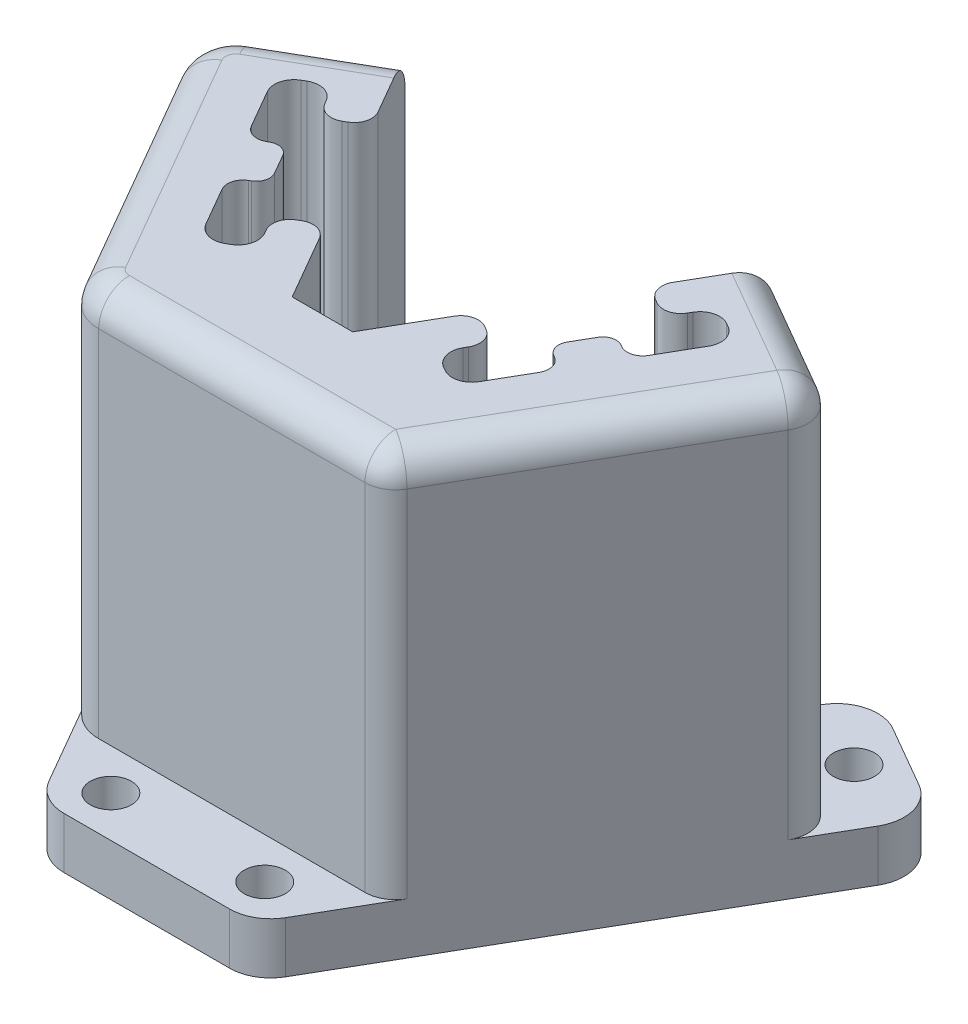
from build123d import *

# Parameters (mm, degrees)
ESQUISSE2_R             = 8.5
BOSS_EXTRU_1_DEPTH      = 23
BOSS_EXTRU_2_DEPTH      = 28
CONG_5_R                = 1.8
BOSS_EXTRU_3_DEPTH      = 42.6
ESQUISSE8_R             = 2.000000000000001
ESQUISSE8_R_2           = 2
ESQUISSE8_R_3           = 2.000000000000003
BOSS_EXTRU_4_DEPTH      = 5
CONG_6_R                = 4
CONG_7_R                = 4
ESQUISSE13_W            = 0.6282051282051283
ESQUISSE13_H            = 3.5
ENL_V_MAT_EXTRU_6_DEPTH = 0.1
CONG_10_R               = 3
CONG_12_R               = 3


with BuildPart() as part:
    # Esquisse2 → Boss.-Extru.1 (new body)
    with BuildSketch(Plane(origin=(0, 0, 0), x_dir=(1, 0, 0), z_dir=(0, 1, 0))):
        Polygon((15, 12), (-15, 12), (-17.89230484541327, 6.990381056766571), (-2.892304845413255, -18.99038105676658), (2.892304845413269, -18.99038105676658), (17.892304845413264, 6.990381056766583), align=None)
        with Locations(Location((0, 0, 0), (0, 0, 270))):
            Circle(ESQUISSE2_R, mode=Mode.SUBTRACT)
    extrude(amount=BOSS_EXTRU_1_DEPTH)

    # Esquisse5 → Boss.-Extru.2 (add)
    with BuildSketch(Plane(origin=(0, 0, 0), x_dir=(1, 0, 0), z_dir=(0, 1, 0))):
        with BuildLine():
            Line((13.220508075688773, -17.101408311032383), (15.37050807568877, -13.37749907475932))
            ThreePointArc((15.37050807568877, -13.37749907475932), (15.510368667195257, -12.315152411615781), (14.858072510390553, -11.46506350946109))
            Line((14.858072510390553, -11.46506350946109), (14.684867429633687, -11.365063509461104))
            ThreePointArc((14.684867429633687, -11.365063509461104), (14.032571272828982, -10.514974607306414), (14.172431864335469, -9.452627944162876))
            Line((14.172431864335469, -9.452627944162876), (15.27243186433546, -7.547372055837128))
            ThreePointArc((15.27243186433546, -7.547372055837128), (16.12252076649015, -6.895075899032422), (17.184867429633687, -7.034936490538909))
            Line((17.184867429633687, -7.034936490538909), (17.358072510390556, -7.134936490538898))
            ThreePointArc((17.358072510390556, -7.134936490538898), (18.420419173534093, -7.274797082045383), (19.27050807568878, -6.622500925240679))
            Line((19.27050807568878, -6.622500925240679), (21.420508075688765, -2.8985916889676107))
            ThreePointArc((21.420508075688765, -2.8985916889676107), (21.600328836197107, -1.5327174077830619), (20.761662348876772, -0.43974596215560235))
            Line((20.761662348876772, -0.43974596215560235), (20.41525218736302, -0.23974596215561678))
            ThreePointArc((20.41525218736302, -0.23974596215561678), (19.049377906178474, -0.05992520164727799), (17.956406460551015, -0.8985916889676114))
            Line((17.956406460551015, -0.8985916889676114), (17.756406460551027, -1.2450018504813638))
            ThreePointArc((17.756406460551027, -1.2450018504813638), (16.663435014923568, -2.0836683378016994), (15.297560733739019, -1.9038475772933587))
            Line((15.297560733739019, -1.9038475772933587), (13.392304845413268, -0.8038475772933659))
            Line((13.392304845413268, -0.8038475772933659), (7.392304845413264, -11.196152422706627))
            Line((7.392304845413264, -11.196152422706627), (9.297560733739017, -12.296152422706623))
            ThreePointArc((9.297560733739017, -12.296152422706623), (10.136227221059352, -13.38912386833408), (9.956406460551012, -14.754998149518629))
            Line((9.956406460551012, -14.754998149518629), (9.756406460551023, -15.101408311032385))
            ThreePointArc((9.756406460551023, -15.101408311032385), (9.576585700042681, -16.467282592216932), (10.415252187363015, -17.56025403784439))
            Line((10.415252187363015, -17.56025403784439), (10.761662348876765, -17.760254037844376))
            ThreePointArc((10.761662348876765, -17.760254037844376), (12.127536630061314, -17.940074798352715), (13.220508075688773, -17.101408311032383))
        make_face()
        with BuildLine():
            Line((-19.27050807568878, -6.622500925240688), (-21.420508075688765, -2.8985916889676204))
            ThreePointArc((-21.420508075688765, -2.8985916889676204), (-21.600328836197107, -1.5327174077830719), (-20.761662348876772, -0.43974596215561174))
            Line((-20.761662348876772, -0.43974596215561174), (-20.41525218736302, -0.2397459621556261))
            ThreePointArc((-20.41525218736302, -0.2397459621556261), (-19.049377906178474, -0.05992520164728754), (-17.956406460551015, -0.8985916889676197))
            Line((-17.956406460551015, -0.8985916889676197), (-17.756406460551027, -1.245001850481372))
            ThreePointArc((-17.756406460551027, -1.245001850481372), (-16.663435014923568, -2.0836683378017056), (-15.297560733739019, -1.9038475772933656))
            Line((-15.297560733739019, -1.9038475772933656), (-13.392304845413268, -0.803847577293372))
            Line((-13.392304845413268, -0.803847577293372), (-7.392304845413259, -11.19615242270663))
            Line((-7.392304845413259, -11.19615242270663), (-9.29756073373901, -12.296152422706626))
            ThreePointArc((-9.29756073373901, -12.296152422706626), (-10.136227221059343, -13.389123868334083), (-9.956406460551005, -14.754998149518633))
            Line((-9.956406460551005, -14.754998149518633), (-9.756406460551016, -15.101408311032387))
            ThreePointArc((-9.756406460551016, -15.101408311032387), (-9.576585700042672, -16.467282592216936), (-10.415252187363008, -17.5602540378444))
            Line((-10.415252187363008, -17.5602540378444), (-10.76166234887676, -17.760254037844383))
            ThreePointArc((-10.76166234887676, -17.760254037844383), (-12.127536630061307, -17.940074798352722), (-13.220508075688766, -17.10140831103239))
            Line((-13.220508075688766, -17.10140831103239), (-15.370508075688763, -13.377499074759328))
            ThreePointArc((-15.370508075688763, -13.377499074759328), (-15.51036866719525, -12.315152411615788), (-14.858072510390546, -11.465063509461098))
            Line((-14.858072510390546, -11.465063509461098), (-14.684867429633684, -11.36506350946111))
            ThreePointArc((-14.684867429633684, -11.36506350946111), (-14.032571272828978, -10.51497460730642), (-14.172431864335465, -9.452627944162883))
            Line((-14.172431864335465, -9.452627944162883), (-15.272431864335456, -7.547372055837135))
            ThreePointArc((-15.272431864335456, -7.547372055837135), (-16.122520766490148, -6.895075899032431), (-17.184867429633687, -7.034936490538918))
            Line((-17.184867429633687, -7.034936490538918), (-17.358072510390556, -7.134936490538907))
            ThreePointArc((-17.358072510390556, -7.134936490538907), (-18.420419173534093, -7.274797082045392), (-19.27050807568878, -6.622500925240688))
        make_face()
    extrude(amount=BOSS_EXTRU_2_DEPTH)

    # Congé5
    cong_5_edges = [part.edges().sort_by_distance(p)[0] for p in [
        (7.392304845413264, 11.5, 11.196152422706627),
        (13.392304845413268, 11.5, 0.8038475772933659),
        (-13.392304845413268, 11.5, 0.803847577293372),
        (-7.392304845413259, 11.5, 11.19615242270663),
    ]]
    fillet(cong_5_edges, radius=CONG_5_R)


with BuildPart() as body_2:
    # Esquisse7 → Boss.-Extru.3 (new body)
    with BuildSketch(Plane(origin=(0, 0, 0), x_dir=(1, 0, 0), z_dir=(0, 1, 0))):
        with BuildLine():
            Line((17.97890738579171, 6.940381056766584), (14.378907385791713, 0.704998149518635))
            ThreePointArc((14.378907385791713, 0.704998149518635), (14.209076667533838, -0.5849942271556619), (15.001150572225267, -1.6172450369149258))
            Line((15.001150572225267, -1.6172450369149258), (15.347560733739023, -1.8172450369149153))
            ThreePointArc((15.347560733739023, -1.8172450369149153), (16.637553110413318, -1.9870757551727904), (17.669803920172583, -1.1950018504813649))
            Line((17.669803920172583, -1.1950018504813649), (17.86980392017257, -0.8485916889676104))
            ThreePointArc((17.86980392017257, -0.8485916889676104), (19.02349600166822, 0.03666738098163247), (20.46525218736302, -0.1531434217771721))
            Line((20.46525218736302, -0.1531434217771721), (20.811662348876776, -0.3531434217771603))
            ThreePointArc((20.811662348876776, -0.3531434217771603), (21.69692141882602, -1.5068355032728113), (21.507110616067212, -2.9485916889676114))
            Line((21.507110616067212, -2.9485916889676114), (19.357110616067224, -6.672500925240681))
            ThreePointArc((19.357110616067224, -6.672500925240681), (18.446301078044343, -7.3713896646742905), (17.308072510390552, -7.221539030917338))
            Line((17.308072510390552, -7.221539030917338), (17.134867429633683, -7.121539030917352))
            ThreePointArc((17.134867429633683, -7.121539030917352), (16.1484026710004, -6.991668481661332), (15.359034404713904, -7.597372055837126))
            Line((15.359034404713904, -7.597372055837126), (14.25903440471391, -9.502627944162876))
            ThreePointArc((14.25903440471391, -9.502627944162876), (14.129163855457888, -10.489092702796162), (14.734867429633686, -11.278460969082658))
            Line((14.734867429633686, -11.278460969082658), (14.908072510390548, -11.378460969082646))
            ThreePointArc((14.908072510390548, -11.378460969082646), (15.60696124982416, -12.289270507105527), (15.457110616067212, -13.427499074759316))
            Line((15.457110616067212, -13.427499074759316), (13.30711061606722, -17.151408311032387))
            ThreePointArc((13.30711061606722, -17.151408311032387), (12.153418534571568, -18.036667380981626), (10.711662348876768, -17.846856578222823))
            Line((10.711662348876768, -17.846856578222823), (10.365252187363014, -17.646856578222838))
            ThreePointArc((10.365252187363014, -17.646856578222838), (9.47999311741377, -16.493164496727186), (9.669803920172576, -15.051408311032384))
            Line((9.669803920172576, -15.051408311032384), (9.869803920172565, -14.70499814951863))
            ThreePointArc((9.869803920172565, -14.70499814951863), (10.039634638430442, -13.415005772844335), (9.247560733739014, -12.38275496308507))
            Line((9.247560733739014, -12.38275496308507), (8.90115057222527, -12.182754963085085))
            ThreePointArc((8.90115057222527, -12.182754963085085), (7.611158195550972, -12.012924244827209), (6.578907385791706, -12.804998149518637))
            Line((6.578907385791706, -12.804998149518637), (2.950039872332232, -19.09038105676658))
            Line((2.950039872332232, -19.09038105676658), (-2.9500398723321997, -19.09038105676658))
            Line((-2.9500398723321997, -19.09038105676658), (-6.578907385791681, -12.804998149518623))
            ThreePointArc((-6.578907385791681, -12.804998149518623), (-7.611158195550957, -12.012924244827193), (-8.90115057222526, -12.182754963085081))
            Line((-8.90115057222526, -12.182754963085081), (-9.247560733739029, -12.382754963085077))
            ThreePointArc((-9.247560733739029, -12.382754963085077), (-10.039634638430423, -13.415005772844339), (-9.869803920172544, -14.70499814951861))
            Line((-9.869803920172544, -14.70499814951861), (-9.669803920172555, -15.051408311032368))
            ThreePointArc((-9.669803920172555, -15.051408311032368), (-9.479993117413752, -16.49316449672717), (-10.365252187362998, -17.64685657822282))
            Line((-10.365252187362998, -17.64685657822282), (-10.711662348876752, -17.84685657822281))
            ThreePointArc((-10.711662348876752, -17.84685657822281), (-12.153418534571555, -18.036667380981605), (-13.307110616067206, -17.151408311032363))
            Line((-13.307110616067206, -17.151408311032363), (-15.457110616067187, -13.427499074759288))
            ThreePointArc((-15.457110616067187, -13.427499074759288), (-15.606961249824135, -12.289270507105497), (-14.908072510390522, -11.378460969082616))
            Line((-14.908072510390522, -11.378460969082616), (-14.73486742963366, -11.278460969082632))
            ThreePointArc((-14.73486742963366, -11.278460969082632), (-14.12916385545786, -10.489092702796135), (-14.259034404713882, -9.50262794416285))
            Line((-14.259034404713882, -9.50262794416285), (-15.359034404713867, -7.5973720558370985))
            ThreePointArc((-15.359034404713867, -7.5973720558370985), (-16.14840267100037, -6.991668481661301), (-17.13486742963366, -7.1215390309173205))
            Line((-17.13486742963366, -7.1215390309173205), (-17.308072510390527, -7.221539030917313))
            ThreePointArc((-17.308072510390527, -7.221539030917313), (-18.44630107804431, -7.371389664674252), (-19.357110616067185, -6.672500925240644))
            Line((-19.357110616067185, -6.672500925240644), (-21.50711061606717, -2.9485916889675763))
            ThreePointArc((-21.50711061606717, -2.9485916889675763), (-21.69692141882597, -1.506835503272772), (-20.811662348876723, -0.35314342177712404))
            Line((-20.811662348876723, -0.35314342177712404), (-20.465252187362978, -0.1531434217771372))
            ThreePointArc((-20.465252187362978, -0.1531434217771372), (-19.02349600166817, 0.03666738098166356), (-17.86980392017252, -0.8485916889675824))
            Line((-17.86980392017252, -0.8485916889675824), (-17.66980392017254, -1.195001850481337))
            ThreePointArc((-17.66980392017254, -1.195001850481337), (-16.637553110413275, -1.9870757551727638), (-15.347560733738979, -1.8172450369148874))
            Line((-15.347560733738979, -1.8172450369148874), (-15.001150572225221, -1.6172450369148992))
            ThreePointArc((-15.001150572225221, -1.6172450369148992), (-14.209076667533793, -0.5849942271556398), (-14.378907385791662, 0.7049981495186519))
            Line((-14.378907385791662, 0.7049981495186519), (-17.978907385791718, 6.940381056766571))
            Line((-17.978907385791718, 6.940381056766571), (-30.96928844255829, -0.5596189432334259))
            Line((-30.96928844255829, -0.5596189432334259), (-15.000000000000004, -28.21923788646685))
            Line((-15.000000000000004, -28.21923788646685), (14.999999999999996, -28.219237886466885))
            Line((14.999999999999996, -28.219237886466885), (30.969288442558344, -0.5596189432334953))
            Line((30.969288442558344, -0.5596189432334953), (17.97890738579171, 6.940381056766584))
        make_face()
    extrude(amount=BOSS_EXTRU_3_DEPTH)

    # Combiner1: cut part
    add(part.part, mode=Mode.SUBTRACT)

    # Esquisse8 → Boss.-Extru.4 (add)
    # profile 1 of 3: a face of its own
    with BuildSketch(Plane(origin=(0, 0, 0), x_dir=(1, 0, 0), z_dir=(0, 1, 0))):
        Polygon((-10.381197846482998, -36.21923788646684), (10.38119784648299, -36.21923788646684), (14.999999999999996, -28.219237886466885), (-15.000000000000004, -28.21923788646685), align=None)
        with Locations(Location((-7.5000000000000036, -32.21923788646685, 0), (0, 0, 270))):
            Circle(ESQUISSE8_R, mode=Mode.SUBTRACT)
        with Locations(Location((7.499999999999998, -32.219237886466864, 0), (0, 0, 270))):
            Circle(ESQUISSE8_R_2, mode=Mode.SUBTRACT)
    # profile 2 of 3: a face of its own
    with BuildSketch(Plane(origin=(0, 0, 0), x_dir=(1, 0, 0), z_dir=(0, 1, 0))):
        Polygon((-30.96928844255829, -0.5596189432334259), (-34.67494088990329, 5.858759370760071), (-21.684559833136717, 13.358759370760067), (-17.978907385791718, 6.940381056766571), align=None)
        with Locations(Location((-26.326924137847506, 6.3995702137633215, 0), (0, 0, 270))):
            Circle(ESQUISSE8_R_3, mode=Mode.SUBTRACT)
    # profile 3 of 3: a face of its own
    with BuildSketch(Plane(origin=(0, 0, 0), x_dir=(1, 0, 0), z_dir=(0, 1, 0))):
        Polygon((30.96928844255829, -0.5596189432334313), (17.978907385791718, 6.940381056766564), (21.684559833136717, 13.358759370760056), (34.67494088990329, 5.858759370760061), align=None)
        with Locations(Location((26.326924137847506, 6.399570213763313, 0), (0, 0, 90))):
            Circle(ESQUISSE8_R_3, mode=Mode.SUBTRACT)
    extrude(amount=BOSS_EXTRU_4_DEPTH)

    # Congé6
    cong_6_edges = [body_2.edges().sort_by_distance(p)[0] for p in [
        (-10.381197846482998, 2.5, 36.21923788646684),
        (10.38119784648299, 2.5, 36.21923788646684),
        (-21.684559833136717, 2.5, -13.358759370760067),
        (-34.67494088990329, 2.5, -5.858759370760071),
        (34.67494088990329, 2.5, -5.858759370760061),
        (21.684559833136717, 2.5, -13.358759370760056),
    ]]
    fillet(cong_6_edges, radius=CONG_6_R)

    # Congé7
    cong_7_edges = [body_2.edges().sort_by_distance(p)[0] for p in [
        (-15.000000000000004, 23.8, 28.21923788646685),
        (-30.96928844255829, 23.8, 0.5596189432334259),
    ]]
    fillet(cong_7_edges, radius=CONG_7_R)

    # Esquisse13 → Enlèv. mat.-Extru.6 (cut)
    # profile 1 of 11: a face of its own
    with BuildSketch(Plane(origin=(-23.46928844255829, 0, 13.55), x_dir=(0.5, 0, 0.8660254037844386), z_dir=(-0.8660254037844387, 0, 0.5000000000000001))):
        Polygon((-6.463557127872238, 31.099999999999998), (-5.880924916333776, 31.099999999999998), (-4.467463377872238, 27.599999999999998), (-5.138436935564545, 27.599999999999998), (-5.410472191974802, 28.317948717948717), (-6.935412095820955, 28.317948717948717), (-7.2074473522312115, 27.599999999999998), (-7.877719788128648, 27.599999999999998), align=None)
        Polygon((-6.172591583000443, 30.161197916666666), (-6.697030685564545, 28.946153846153848), (-5.64815248043634, 28.946153846153848), align=None, mode=Mode.SUBTRACT)
    # profile 2 of 11: a face of its own
    with BuildSketch(Plane(origin=(-23.46928844255829, 0, 13.55), x_dir=(0.5, 0, 0.8660254037844386), z_dir=(-0.8660254037844387, 0, 0.5000000000000001))):
        with BuildLine():
            Line((-3.951437736846597, 31.099999999999998), (-3.219466583000443, 31.099999999999998))
            add(Edge.make_bspline(
                [(-3.219466583000443, 31.099999999999998), (-3.1710835125404886, 31.099828267867757), (-3.078029239255021, 31.099497978603072), (-2.943850059717119, 31.094286888894278), (-2.820588030663225, 31.08703522985502), (-2.7080606515101753, 31.075969005689327), (-2.606316063325304, 31.061296530094065), (-2.5152522942505398, 31.044000109340786), (-2.4348720059900337, 31.024287129643756), (-2.364497301823928, 30.999723201635746), (-2.3009876112734244, 30.972015463253197), (-2.2417877501414334, 30.940178763785468), (-2.1855916814584426, 30.904567614949688), (-2.1327750152500613, 30.86424499102782), (-2.082878762269157, 30.819936286090325), (-2.0358087902429767, 30.771596899075004), (-1.9922302415042634, 30.7188169318894), (-1.9524129561957593, 30.661929886947142), (-1.916122705721628, 30.602086020166144), (-1.8840497356758095, 30.539203165526757), (-1.8579679431258438, 30.47323759219181), (-1.8349218835017598, 30.405142645310146), (-1.8183225533675833, 30.333944894256767), (-1.8067779620864022, 30.26033746115667), (-1.7983254639754098, 30.18406124003022), (-1.7978394857436752, 30.132242562022352), (-1.7975915830004434, 30.105809294871793)],
                knots=[0, 0, 0, 0, 1.7493366388809215, 3.3644671186678625, 4.854658418999021, 6.213483162035105, 7.451590619171479, 8.570285859152053, 9.564325599683178, 10.44090026088279, 11.262035659902903, 12.06732066936659, 12.86905071164549, 13.665104638540928, 14.467235401161433, 15.279979160082625, 16.102287765457035, 16.93927200550351, 17.78853746990106, 18.631303465835067, 19.488103221910436, 20.35125541941349, 21.228522268715494, 22.12737980506094, 23.04475621943059, 24, 24, 24, 24], degree=3))
            add(Edge.make_bspline(
                [(-1.7975915830004434, 30.105809294871793), (-1.798235545178225, 30.078219036282626), (-1.7994982376410482, 30.02411956775809), (-1.80629978617863, 29.944651860824777), (-1.8187308803259439, 29.868622717357095), (-1.8375595808994358, 29.796254741333442), (-1.8592007265733816, 29.726647228924666), (-1.887977899054257, 29.661084482261433), (-1.9204557824374946, 29.598612986176448), (-1.9590288156280649, 29.540116423659754), (-2.001360835133299, 29.48429546918749), (-2.0505920833393656, 29.433288830610824), (-2.1035331315760946, 29.38435509423723), (-2.163159988972743, 29.340559303296686), (-2.226844248265805, 29.298940144663458), (-2.2958512486844116, 29.261222103337566), (-2.3697306268775153, 29.226457034607396), (-2.4216714884843205, 29.207069630833054), (-2.4482326086414687, 29.197155448717947)],
                knots=[0, 0, 0, 0, 1.0998602092698435, 2.156625411120546, 3.176576792971071, 4.166170409694736, 5.135385251715151, 6.0784615933464, 7.01604697240429, 7.938469503620306, 8.868247731336002, 9.803980173051109, 10.76021508041885, 11.738342430367574, 12.748633911703271, 13.790971184656389, 14.870363756398373, 16, 16, 16, 16], degree=3))
            Line((-2.4482326086414687, 29.197155448717947), (-1.6405403009491613, 27.599999999999998))
            Line((-1.6405403009491613, 27.599999999999998), (-2.338857608641469, 27.599999999999998))
            Line((-2.338857608641469, 27.599999999999998), (-3.110091583000443, 29.125641025641023))
            Line((-3.110091583000443, 29.125641025641023), (-3.323232608641469, 29.125641025641023))
            Line((-3.323232608641469, 29.125641025641023), (-3.323232608641469, 27.599999999999998))
            Line((-3.323232608641469, 27.599999999999998), (-3.951437736846597, 27.599999999999998))
            Line((-3.951437736846597, 27.599999999999998), (-3.951437736846597, 31.099999999999998))
        make_face()
        with BuildLine():
            Line((-3.323232608641469, 29.75384615384615), (-3.078541102231213, 29.75384615384615))
            add(Edge.make_bspline(
                [(-3.078541102231213, 29.75384615384615), (-3.0486255315722026, 29.754183083109275), (-2.991343641815373, 29.75482823025108), (-2.9089647608728093, 29.757820690113505), (-2.834145090659883, 29.765031039699345), (-2.7665633302632155, 29.77414104692463), (-2.705879414405098, 29.784659865875717), (-2.6526346222063952, 29.799733972074858), (-2.6060085326864963, 29.81588625845809), (-2.566553666752027, 29.835959360498563), (-2.532844335871572, 29.858786831193633), (-2.5037384862095426, 29.884719405362766), (-2.4796637752685773, 29.914733057905345), (-2.459849060185286, 29.948012147215806), (-2.444435366131298, 29.984851018645564), (-2.4331845503026948, 30.024845264858016), (-2.426897008014531, 30.068450471762763), (-2.426173604857199, 30.09854400194723), (-2.4257967112055714, 30.114222756410257)],
                knots=[0, 0, 0, 0, 1.6886399430441228, 3.2333826474174003, 4.650958383078752, 5.928841753939051, 7.082724185062018, 8.122798841181982, 9.04917125569673, 9.863274651977964, 10.613301712081688, 11.341792391945813, 12.054588805594014, 12.776240172593706, 13.521029143041853, 14.301969904134477, 15.115324896058436, 16, 16, 16, 16], degree=3))
            add(Edge.make_bspline(
                [(-2.4257967112055714, 30.114222756410257), (-2.426509263185638, 30.132771867546552), (-2.427908939506905, 30.169208159023285), (-2.4417980769595418, 30.221663642614317), (-2.4639065836430696, 30.270214781603798), (-2.4942112909212995, 30.314642209918482), (-2.5323761298723353, 30.353590360488386), (-2.5761732936784654, 30.387923465394355), (-2.6265480308447846, 30.415071515804172), (-2.6731912467054175, 30.432978080797703), (-2.7156256706779653, 30.44369176335837), (-2.7539213995289686, 30.45167550485314), (-2.798268084107807, 30.457333811605842), (-2.8486992037370817, 30.46333545310856), (-2.905086207776636, 30.467227213828338), (-2.9677364391239953, 30.47006742343187), (-3.0364699667813047, 30.471229492710954), (-3.084383763590384, 30.471600985783795), (-3.1093904612055714, 30.471794871794874)],
                knots=[0, 0, 0, 0, 1.0203033593238515, 2.0041968761659836, 2.966617322662231, 3.9489081999373425, 4.950758221595129, 5.960522915472123, 7.003732011789727, 8.09199226788214, 8.70421220978032, 9.413913587306084, 10.246224310312192, 11.166358409403326, 12.212345908721575, 13.35965766142901, 14.621978493494998, 16, 16, 16, 16], degree=3))
            Line((-3.1093904612055714, 30.471794871794874), (-3.323232608641469, 30.471794871794874))
            Line((-3.323232608641469, 30.471794871794874), (-3.323232608641469, 29.75384615384615))
        make_face(mode=Mode.SUBTRACT)
    # profile 3 of 11: a face of its own
    with BuildSketch(Plane(origin=(-23.46928844255829, 0, 13.55), x_dir=(0.5, 0, 0.8660254037844386), z_dir=(-0.8660254037844387, 0, 0.5000000000000001))):
        Polygon((-1.4834890188978802, 31.099999999999998), (0.4011263657175046, 31.099999999999998), (0.4011263657175046, 30.471794871794874), (-0.22707876248762374, 30.471794871794874), (-0.22707876248762374, 27.599999999999998), (-0.8552838906927518, 27.599999999999998), (-0.8552838906927518, 30.471794871794874), (-1.4834890188978802, 30.471794871794874), align=None)
    # profile 4 of 11: a face of its own
    with BuildSketch(Plane(origin=(-23.46928844255829, 0, 13.55), x_dir=(0.5, 0, 0.8660254037844386), z_dir=(-0.8660254037844387, 0, 0.5000000000000001))):
        with Locations((1.1190750836662249, 29.349999999999998)):
            Rectangle(ESQUISSE13_W, ESQUISSE13_H)
    # profile 5 of 11: a face of its own
    with BuildSketch(Plane(origin=(-23.46928844255829, 0, 13.55), x_dir=(0.5, 0, 0.8660254037844386), z_dir=(-0.8660254037844387, 0, 0.5000000000000001))):
        with BuildLine():
            Line((4.035741750332892, 30.632351762820512), (3.5659901477687885, 30.2025641025641))
            add(Edge.make_bspline(
                [(3.5659901477687885, 30.2025641025641), (3.545868003365331, 30.230948479156453), (3.507236292215819, 30.285442523910767), (3.444618317893826, 30.35841133421955), (3.3822830958215704, 30.420659159688356), (3.3196531280752613, 30.471925957654257), (3.256173286455975, 30.511900244182986), (3.1919537626932852, 30.540202480634175), (3.127358635233051, 30.55819448093155), (3.0839606807627873, 30.560434917852348), (3.06258469905084, 30.561538461538458)],
                knots=[0, 0, 0, 0, 1.2993624576115235, 2.4945947178644032, 3.5874621343406314, 4.587049575088399, 5.512617174988365, 6.380583204010017, 7.202344344620629, 8, 8, 8, 8], degree=3))
            add(Edge.make_bspline(
                [(3.06258469905084, 30.561538461538458), (3.042645796460296, 30.560839205636324), (3.004149014131406, 30.559489126205694), (2.9492689949282096, 30.546069437291138), (2.9005457323074504, 30.522909024953794), (2.858026778022248, 30.492624837418152), (2.824345493070596, 30.45613941242404), (2.797453598948033, 30.417875582800658), (2.78231120285182, 30.375640968473963), (2.780318165592847, 30.346632531632903), (2.779331493922635, 30.332271634615385)],
                knots=[0, 0, 0, 0, 1.1850100668732506, 2.2879430999175923, 3.3330751484849257, 4.379039566410081, 5.372662700881706, 6.275205909567936, 7.1461246104077665, 8, 8, 8, 8], degree=3))
            add(Edge.make_bspline(
                [(2.779331493922635, 30.332271634615385), (2.7799497910424478, 30.31770364706746), (2.7811949555174755, 30.288365744647955), (2.7932215493777885, 30.245367394918), (2.811349060358074, 30.203353001845826), (2.828670637184654, 30.177776841565937), (2.837524602896994, 30.164703525641023)],
                knots=[0, 0, 0, 0, 0.9675254990007636, 1.9484618987135103, 2.9513513585855744, 4, 4, 4, 4], degree=3))
            add(Edge.make_bspline(
                [(2.837524602896994, 30.164703525641023), (2.8455738155095007, 30.154541773968788), (2.8641020399147386, 30.131150763643014), (2.8994315690474797, 30.094103049500752), (2.9437980378443953, 30.04871635682815), (2.9989087613900156, 29.996551400990718), (3.062475942041355, 29.93573212616393), (3.137446000678661, 29.868649361188318), (3.221660972077396, 29.793225630798002), (3.2815190226536752, 29.740703276202108), (3.312885179820071, 29.71318108974359)],
                knots=[0, 0, 0, 0, 0.4738735129835339, 1.0907942442239302, 1.8704416964945219, 2.795289790855136, 3.8654332027933247, 5.087734844472895, 6.473946850940723, 8, 8, 8, 8], degree=3))
            add(Edge.make_bspline(
                [(3.312885179820071, 29.71318108974359), (3.3423268302880995, 29.68770082631295), (3.398200966159744, 29.639344580031352), (3.4776987659166276, 29.57071065250068), (3.5475640916793876, 29.508962381418534), (3.6088147218106963, 29.45502647620468), (3.6605221565041517, 29.40833702572762), (3.7029037739860318, 29.368670854955017), (3.7364771938622106, 29.336800191280762), (3.7555617172956364, 29.317550291033417), (3.763706493922635, 29.309334935897436)],
                knots=[0, 0, 0, 0, 1.5436216173194974, 2.929473131072472, 4.1636583863556895, 5.240097081520091, 6.164993804608004, 6.925417477434939, 7.541396218558956, 8, 8, 8, 8], degree=3))
            add(Edge.make_bspline(
                [(3.763706493922635, 29.309334935897436), (3.794606078400144, 29.275894967775702), (3.8540059312171633, 29.211611605451452), (3.931204800052918, 29.111992610547), (3.9947419662357055, 29.01474415879931), (4.04389552285663, 28.918036362833845), (4.081018265786204, 28.8204739216382), (4.107190291318795, 28.719664121633688), (4.122864891550446, 28.614553563585233), (4.124605138138614, 28.542828439235393), (4.125485340076481, 28.50655048076923)],
                knots=[0, 0, 0, 0, 1.2066647787260472, 2.3196334665270153, 3.337109185216446, 4.282041471250102, 5.190008762349344, 6.099243692688983, 7.038613610000831, 8, 8, 8, 8], degree=3))
            add(Edge.make_bspline(
                [(4.125485340076481, 28.50655048076923), (4.124858834873318, 28.47120205934587), (4.12362960834685, 28.401847140882342), (4.108573940687779, 28.30035654852852), (4.0871054422763855, 28.20322564690176), (4.053911377500215, 28.111511357522), (4.013454647929574, 28.023708218282867), (3.9627362943293862, 27.941183922910334), (3.9031745425110698, 27.863103291801878), (3.8349076296641194, 27.790862111717153), (3.759396317733597, 27.72530824798632), (3.678403259220733, 27.666950650161844), (3.591136463232195, 27.618769019771513), (3.498341523520447, 27.579094883894367), (3.400068111112939, 27.548537333953977), (3.2964332992676972, 27.525952456606937), (3.18727857147161, 27.512397369233653), (3.112636995673455, 27.510980345669196), (3.0745037695636603, 27.51025641025641)],
                knots=[0, 0, 0, 0, 1.0432140046105092, 2.0468247043684977, 3.024750560303484, 3.9766990891113707, 4.921714032357538, 5.875962560963398, 6.831408891541138, 7.81787405176627, 8.806269674033995, 9.781291747608961, 10.76089736689733, 11.744387050067076, 12.757449933391017, 13.795994037065245, 14.87400745719514, 16, 16, 16, 16], degree=3))
            add(Edge.make_bspline(
                [(3.0745037695636603, 27.51025641025641), (3.044569511794457, 27.510787463930836), (2.9852825140941257, 27.51183925476585), (2.897902442632461, 27.52042625147382), (2.813527105861872, 27.534284750534052), (2.7322515450623297, 27.55414811957616), (2.6537095994802633, 27.579317702186316), (2.577898043508422, 27.61006138314857), (2.505340229488553, 27.646855678002773), (2.435487150601061, 27.688943949754087), (2.368678379010869, 27.737813977287104), (2.3040691440790733, 27.792466628881915), (2.2423012060724257, 27.853742486769136), (2.1830779061086787, 27.921496635914007), (2.126778171372765, 27.99592093979257), (2.0715591095274073, 28.075978902243204), (2.0198748218404714, 28.1631562903612), (1.9879471382603335, 28.224311933331744), (1.971639186230327, 28.25554887820513)],
                knots=[0, 0, 0, 0, 1.016823715772488, 2.0138941063261457, 2.979844003418765, 3.919626410111016, 4.853723002832966, 5.779685072652865, 6.695824784453624, 7.614987387657172, 8.54725990110594, 9.504950863480623, 10.487499108157971, 11.500346958398199, 12.559593715504912, 13.656357062027215, 14.802919212350895, 16, 16, 16, 16], degree=3))
            Line((1.971639186230327, 28.25554887820513), (2.5241231605893013, 28.587179487179487))
            add(Edge.make_bspline(
                [(2.5241231605893013, 28.587179487179487), (2.544521971222713, 28.551721473384944), (2.583628234608215, 28.483745430492277), (2.6498974538455107, 28.3924110014607), (2.717786885810317, 28.314198181610497), (2.788866073341245, 28.250489387549475), (2.8622707201142163, 28.200432750811974), (2.9383553876302893, 28.16465880550524), (3.0171735315120007, 28.142514773828967), (3.070860870461641, 28.139810476101385), (3.0976407887944295, 28.138461538461538)],
                knots=[0, 0, 0, 0, 1.2836633644475166, 2.4608923789988992, 3.537111102046176, 4.529833553362693, 5.449777664121711, 6.316464041949039, 7.1602311392410884, 8, 8, 8, 8], degree=3))
            add(Edge.make_bspline(
                [(3.0976407887944295, 28.138461538461538), (3.1248797997370756, 28.13956315408015), (3.177727448097043, 28.141700448821236), (3.253160703489669, 28.161441995952966), (3.322320768236764, 28.192437673196835), (3.382102217418925, 28.23666423041702), (3.432721379383822, 28.28770839938151), (3.4700812264586385, 28.344497371305568), (3.493550934379252, 28.405941668091636), (3.4960322515282303, 28.448624918359073), (3.4972802118713533, 28.470092147435896)],
                knots=[0, 0, 0, 0, 1.135887140237374, 2.2037864844017085, 3.2347667413051346, 4.283437686885034, 5.291419208498046, 6.222934723702111, 7.106237994254766, 8, 8, 8, 8], degree=3))
            add(Edge.make_bspline(
                [(3.4972802118713533, 28.470092147435896), (3.4961277715770116, 28.49006391073953), (3.4937866994471647, 28.530634635907322), (3.4765430836086564, 28.59095678039285), (3.4495860525085575, 28.651251491611227), (3.417693983769093, 28.700706844995064), (3.385239810409597, 28.742114471772435), (3.354206300622318, 28.77799230727405), (3.3164156950548835, 28.817631034452255), (3.2719638140150447, 28.86108051581973), (3.2214379828368482, 28.908723248155606), (3.164795640055575, 28.960554566095468), (3.101388170925691, 29.016117897718154), (3.056571646634044, 29.053967090265576), (3.0331375836662247, 29.073758012820512)],
                knots=[0, 0, 0, 0, 0.9161592762380865, 1.861089861776012, 2.860218735102706, 3.940849679195869, 4.552606314616352, 5.275411730097877, 6.117976989975774, 7.066495739963497, 8.129236252913396, 9.306560635436112, 10.591630460710254, 12, 12, 12, 12], degree=3))
            add(Edge.make_bspline(
                [(3.0331375836662247, 29.073758012820512), (2.9885884972666803, 29.11145081182462), (2.9030853164549058, 29.183794701879872), (2.7822584740207197, 29.290644350072135), (2.6733826702987322, 29.390505136852816), (2.5773982736564576, 29.484611559845693), (2.4930822943921056, 29.5712256914988), (2.42100575695268, 29.651051044922824), (2.3619604548765056, 29.724703363539664), (2.299828006223856, 29.811939606243374), (2.240789757434061, 29.918242962103776), (2.18976395684876, 30.046138222532356), (2.156660571077231, 30.17401725494888), (2.152951797111029, 30.259868193843225), (2.1511263657175066, 30.302123397435896)],
                knots=[0, 0, 0, 0, 1.3454949753569376, 2.5824121089148955, 3.718829429921703, 4.751509155985097, 5.681369928003992, 6.505683930792368, 7.230279996664903, 7.856715994008164, 8.973648663769211, 10.023341001900096, 11.027102912633383, 12, 12, 12, 12], degree=3))
            add(Edge.make_bspline(
                [(2.1511263657175066, 30.302123397435896), (2.1518855602015865, 30.332088519815432), (2.1533812548871314, 30.39112302972639), (2.1667230822141605, 30.477924674965323), (2.1866629514523357, 30.561680969255725), (2.215621366144994, 30.64208633147903), (2.253205891845402, 30.71904005068231), (2.298850838399039, 30.79291884770966), (2.3532649853274874, 30.863042758799633), (2.4145860554171796, 30.92936529674291), (2.482146174727395, 30.98997654896263), (2.554342747862323, 31.04347205229777), (2.630767135841511, 31.08865513228089), (2.710951812957432, 31.126137777988323), (2.7953936502897885, 31.15482836219254), (2.883470568691719, 31.175165678334096), (2.9753088984065736, 31.1872616654151), (3.037775347908185, 31.188905974494396), (3.069595916999558, 31.18974358974359)],
                knots=[0, 0, 0, 0, 1.0107660817043456, 1.9913177564319993, 2.957454644087339, 3.9130691434299183, 4.86910676189848, 5.843196583382672, 6.838735724423583, 7.860187025236582, 8.887984030896355, 9.897672290286057, 10.88791622280494, 11.879572884169693, 12.879850636236327, 13.892031538940486, 14.926195476247617, 15.999999999999998, 15.999999999999998, 15.999999999999998, 15.999999999999998], degree=3))
            add(Edge.make_bspline(
                [(3.069595916999558, 31.18974358974359), (3.110833799611751, 31.188235020138308), (3.1929840474394515, 31.185229789047646), (3.3144455582147305, 31.1617298639523), (3.4330840836821683, 31.12477375636671), (3.5286852309099133, 31.080190278457845), (3.604753279261445, 31.037002242311335), (3.6630523325948605, 30.997240138906808), (3.7223747573879344, 30.951690512386268), (3.783198952197674, 30.90020982385389), (3.8443947093004085, 30.841828109527405), (3.9077021167306545, 30.777935192075315), (3.9722585336803795, 30.707978887268453), (4.0142099690490065, 30.658002427493912), (4.035741750332892, 30.632351762820512)],
                knots=[0, 0, 0, 0, 1.2829226365343995, 2.5557183312779284, 3.837320111493227, 5.1426752741903305, 5.830281639341115, 6.558704239688274, 7.337177975010173, 8.15785092086992, 9.037902056289905, 9.969034429875164, 10.957596895868425, 11.999999999999998, 11.999999999999998, 11.999999999999998, 11.999999999999998], degree=3))
        make_face()
    # profile 6 of 11: a face of its own
    with BuildSketch(Plane(origin=(-23.46928844255829, 0, 13.55), x_dir=(0.5, 0, 0.8660254037844386), z_dir=(-0.8660254037844387, 0, 0.5000000000000001))):
        Polygon((5.831314666999558, 31.099999999999998), (6.413946878538019, 31.099999999999998), (7.827408416999558, 27.599999999999998), (7.15643485930725, 27.599999999999998), (6.884399602896994, 28.317948717948717), (5.3594596990508405, 28.317948717948717), (5.087424442640584, 27.599999999999998), (4.417152006743147, 27.599999999999998), align=None)
        Polygon((6.122280211871352, 30.161197916666666), (5.59784110930725, 28.946153846153848), (6.6467193144354555, 28.946153846153848), align=None, mode=Mode.SUBTRACT)
    # profile 7 of 11: a face of its own
    with BuildSketch(Plane(origin=(-23.46928844255829, 0, 13.55), x_dir=(0.5, 0, 0.8660254037844386), z_dir=(-0.8660254037844387, 0, 0.5000000000000001))):
        Polygon((8.343434058025203, 31.099999999999998), (8.909239346486741, 31.099999999999998), (10.497280211871356, 28.796814903846155), (10.497280211871356, 31.099999999999998), (11.125485340076485, 31.099999999999998), (11.125485340076485, 27.599999999999998), (10.555473320845715, 27.599999999999998), (8.971639186230332, 29.89617387820513), (8.971639186230332, 27.599999999999998), (8.343434058025203, 27.599999999999998), align=None)
    # profile 8 of 11: a face of its own
    with BuildSketch(Plane(origin=(-23.46928844255829, 0, 13.55), x_dir=(0.5, 0, 0.8660254037844386), z_dir=(-0.8660254037844387, 0, 0.5000000000000001))):
        Polygon((-3.8168223522312132, 24.401282051282053), (-3.1458487945389053, 24.401282051282053), (-2.2463095317183925, 21.91510416666667), (-1.3446669035132641, 24.401282051282053), (-0.675796711205572, 24.401282051282053), (-1.9448271599235207, 20.901282051282053), (-2.5498952688978798, 20.901282051282053), align=None)
    # profile 9 of 11: a face of its own
    with BuildSketch(Plane(origin=(-23.46928844255829, 0, 13.55), x_dir=(0.5, 0, 0.8660254037844386), z_dir=(-0.8660254037844387, 0, 0.5000000000000001))):
        Polygon((1.6063547311021225, 24.401282051282053), (2.5774084169995586, 24.401282051282053), (2.5774084169995586, 20.901282051282053), (1.9492032887944302, 20.901282051282053), (1.9492032887944302, 23.81794871794872), (1.2312545708457123, 23.81794871794872), align=None)
    # profile 10 of 11: a face of its own
    with BuildSketch(Plane(origin=(-23.46928844255829, 0, 13.55), x_dir=(0.5, 0, 0.8660254037844386), z_dir=(-0.8660254037844387, 0, 0.5000000000000001))):
        with BuildLine():
            add(Edge.make_bspline(
                [(4.170357134948275, 21.619230769230768), (4.195717031138283, 21.617840347035298), (4.245646286825211, 21.615102845872425), (4.3177872535097865, 21.59467316135682), (4.382894891506577, 21.55796832244498), (4.441109819197062, 21.51009322181702), (4.49033489607212, 21.452493083697775), (4.525913668407125, 21.386807168606005), (4.5480694623106235, 21.314944170964452), (4.550515477480975, 21.26485783174041), (4.551767391358532, 21.239222756410257)],
                knots=[0, 0, 0, 0, 1.0169570005786288, 2.002212695354198, 2.975754500410231, 3.994999759673005, 5.013036768415396, 5.994806403533872, 6.97370640990521, 8, 8, 8, 8], degree=3))
            add(Edge.make_bspline(
                [(4.551767391358532, 21.239222756410257), (4.5505236787176235, 21.213583564002104), (4.548093687292688, 21.163489180746094), (4.52576035244636, 21.091486152758407), (4.490388062052204, 21.02526035946876), (4.4411058697072985, 20.96704299806234), (4.383135979749869, 20.918265646203025), (4.317637559720719, 20.881899279610018), (4.2457837139906935, 20.86031067096319), (4.195741219867508, 20.857722903165406), (4.170357134948275, 20.856410256410257)],
                knots=[0, 0, 0, 0, 1.0232189118650137, 1.99918622668715, 2.986238111464962, 4.008388922544233, 5.030539733623506, 6.001164899793135, 6.986089706114684, 7.999999999999999, 7.999999999999999, 7.999999999999999, 7.999999999999999], degree=3))
            add(Edge.make_bspline(
                [(4.170357134948275, 20.856410256410257), (4.1449670353065695, 20.857712229202534), (4.094912683686256, 20.860278954219933), (4.02294714618426, 20.88208125035783), (3.9569651659761944, 20.918022850348162), (3.8989807107498944, 20.96710216487781), (3.849478347526418, 21.025054206836167), (3.8151117241257495, 21.091695106950016), (3.792570360473032, 21.163462034690653), (3.7901735887481802, 21.213574373851866), (3.788946878538019, 21.239222756410257)],
                knots=[0, 0, 0, 0, 1.0134275177895267, 1.9978833495326545, 2.976245624233684, 3.997909735472888, 5.019573846712099, 6.001765691176861, 6.977268296554091, 8, 8, 8, 8], degree=3))
            add(Edge.make_bspline(
                [(3.788946878538019, 21.239222756410257), (3.790181681825576, 21.26486718183147), (3.792594265972064, 21.314971789456386), (3.814958844817633, 21.386595807516063), (3.8495334261759764, 21.452700356411956), (3.8989765825100973, 21.51003393192205), (3.9572074960712187, 21.55820922301309), (4.022796612359481, 21.59449368394531), (4.095050041473449, 21.615134797209212), (4.144991195429997, 21.617851109310656), (4.170357134948275, 21.619230769230768)],
                knots=[0, 0, 0, 0, 1.0258082149347465, 2.004245260461507, 2.9811101577631174, 3.9986656962120013, 5.017428913751412, 5.998734230863443, 6.983523958935966, 8, 8, 8, 8], degree=3))
        make_face()
    # profile 11 of 11: a face of its own
    with BuildSketch(Plane(origin=(-23.46928844255829, 0, 13.55), x_dir=(0.5, 0, 0.8660254037844386), z_dir=(-0.8660254037844387, 0, 0.5000000000000001))):
        with BuildLine():
            Line((5.673562263153409, 23.234615384615385), (5.04535713494828, 23.234615384615385))
            add(Edge.make_bspline(
                [(5.04535713494828, 23.234615384615385), (5.048070256552054, 23.28213577908776), (5.0533715332711475, 23.374987776782245), (5.074458672164137, 23.509858276540726), (5.102714714596385, 23.63729606786257), (5.14042615425876, 23.756855359468403), (5.187813045711773, 23.86849270735447), (5.243656002141486, 23.97258868932088), (5.309381684221251, 24.06859523771609), (5.3835912332758555, 24.15604935476797), (5.465024775306784, 24.234505250191596), (5.551991670020604, 24.304069175891907), (5.645822193272594, 24.361471576688768), (5.744801984643941, 24.408708438136006), (5.848914189918364, 24.44644849542714), (5.959143874084434, 24.471680777791583), (6.0745366088448085, 24.488768326589895), (6.153532279985567, 24.49026355567136), (6.19379463494828, 24.49102564102564)],
                knots=[0, 0, 0, 0, 1.1990385632123841, 2.342849362745223, 3.4360475461746987, 4.4867445870599445, 5.497670872309833, 6.488682221098536, 7.459191390892409, 8.42461031719147, 9.374430500947346, 10.30543319385268, 11.225809215813861, 12.140057398985144, 13.066071190236256, 14.010487599284872, 14.985989316584467, 16, 16, 16, 16], degree=3))
            add(Edge.make_bspline(
                [(6.19379463494828, 24.49102564102564), (6.243216104482649, 24.48948356089005), (6.3396983947938255, 24.486473059083295), (6.4798948155284695, 24.46079247954466), (6.610822943892547, 24.41783774183146), (6.732387607436054, 24.35781864505229), (6.8435539048010705, 24.281570674071403), (6.944303401593344, 24.190657447533436), (7.031589272383398, 24.08317155826547), (7.105964935234603, 23.963585318731962), (7.167762222013489, 23.836960321397683), (7.211067186434291, 23.70602482323779), (7.239531073471323, 23.574253321466227), (7.242566923193603, 23.48552506181709), (7.244075083666229, 23.441446314102564)],
                knots=[0, 0, 0, 0, 1.0753743465853847, 2.0993827354383168, 3.0905775104947977, 4.06680944988113, 5.040638230598276, 6.016817125432337, 7.0110243205914875, 8.04444572074358, 9.077679199899023, 10.070479128598178, 11.041445599893857, 12, 12, 12, 12], degree=3))
            add(Edge.make_bspline(
                [(7.244075083666229, 23.441446314102564), (7.243487885624617, 23.41478437214307), (7.242306001012137, 23.361120468812896), (7.234088200251573, 23.27991381208984), (7.221759875270886, 23.19719533796845), (7.20317176562805, 23.1130359698309), (7.17999086901898, 23.027412116480242), (7.151869090877372, 22.940067535153275), (7.118154118893314, 22.85149743760221), (7.0794085875004065, 22.760704982526985), (7.033185070351972, 22.667395402388326), (6.97936420971759, 22.57016995023893), (6.916517477995269, 22.469114872712886), (6.845403984437681, 22.363659579933113), (6.765678347875865, 22.25397039122805), (6.676951374065821, 22.140377724664802), (6.580244989388553, 22.02248131593136), (6.511609747699607, 21.94367418286001), (6.476346718281614, 21.903185096153848)],
                knots=[0, 0, 0, 0, 0.7282840264210899, 1.465855849890643, 2.2279448805371542, 3.0118650195744587, 3.8187692699606006, 4.650621989130264, 5.517437689258126, 6.406905707762846, 7.346299481812716, 8.360816761513824, 9.441613733168717, 10.59615450439788, 11.834900912020121, 13.145207542166744, 14.533280746951139, 15.999999999999998, 15.999999999999998, 15.999999999999998, 15.999999999999998], degree=3))
            Line((6.476346718281614, 21.903185096153848), (6.111062263153409, 21.484615384615388))
            Line((6.111062263153409, 21.484615384615388), (7.288946878538025, 21.484615384615388))
            Line((7.288946878538025, 21.484615384615388), (7.288946878538025, 20.901282051282053))
            Line((7.288946878538025, 20.901282051282053), (4.955613545204691, 20.901282051282053))
            Line((4.955613545204691, 20.901282051282053), (4.955613545204691, 21.219591346153848))
            Line((4.955613545204691, 21.219591346153848), (5.9918715580252035, 22.32245592948718))
            add(Edge.make_bspline(
                [(5.9918715580252035, 22.32245592948718), (6.021873890444437, 22.354626831846993), (6.079979511022849, 22.41693232930179), (6.162657821005161, 22.508434580807105), (6.237474388146468, 22.595268033355328), (6.302877830079415, 22.678357288043323), (6.362300435240269, 22.755007267579078), (6.413092554331186, 22.827528297999944), (6.455718895476925, 22.8952647630689), (6.501995834568824, 22.976943109870543), (6.545943714414045, 23.074359073024095), (6.586268554034777, 23.186586256919565), (6.610849334331214, 23.293849598147315), (6.614242259365581, 23.363744696982497), (6.6158699554611005, 23.39727564102564)],
                knots=[0, 0, 0, 0, 1.246127091161035, 2.413378631358278, 3.493388632550618, 4.492180847656362, 5.408488754230465, 6.240484944196337, 6.999099869344055, 7.6749395979039035, 8.898438119379234, 10.020720584180836, 11.050475520549996, 12, 12, 12, 12], degree=3))
            add(Edge.make_bspline(
                [(6.6158699554611005, 23.39727564102564), (6.614652966419624, 23.42971424250133), (6.612294855036389, 23.492569233622092), (6.586381121737368, 23.581980123837155), (6.546234667334866, 23.66293255768516), (6.489662643218756, 23.733007585160827), (6.42113620384427, 23.7905928818642), (6.3419474661921535, 23.83342320771816), (6.252742051407339, 23.858136109424162), (6.1902073560225785, 23.861229281802792), (6.158037423409819, 23.862820512820516)],
                knots=[0, 0, 0, 0, 1.0620389739807232, 2.05787078488852, 3.0288058534108337, 4.011250219987626, 4.991535629175631, 5.9491346789971775, 6.944966489904989, 8, 8, 8, 8], degree=3))
            add(Edge.make_bspline(
                [(6.158037423409819, 23.862820512820516), (6.1414180264383775, 23.862232693016004), (6.108700074562971, 23.861075475331837), (6.060607242627224, 23.853372190308928), (6.014843457830354, 23.839795954536132), (5.9708993437815705, 23.82160570944744), (5.929243883630397, 23.797494408984583), (5.889982145644157, 23.767773389756705), (5.852700457803074, 23.733197930387202), (5.817569808884615, 23.693876143748554), (5.785596332226115, 23.64999301831932), (5.757197607171661, 23.60194933671011), (5.733716589226404, 23.54977492106113), (5.713043047594187, 23.494158553351053), (5.697098623036831, 23.43450286845317), (5.685489103988953, 23.3711648989807), (5.676663161941906, 23.30424768752335), (5.674614699689767, 23.258248397070673), (5.673562263153409, 23.234615384615385)],
                knots=[0, 0, 0, 0, 0.9034698955498148, 1.7786255791514127, 2.638993550015756, 3.4931480370015087, 4.358286771972425, 5.2476214951632825, 6.164656831744351, 7.118446692685106, 8.109501107517374, 9.111810964207491, 10.146451448859585, 11.215617524960777, 12.334359949540323, 13.498009768892471, 14.71455481784865, 16, 16, 16, 16], degree=3))
        make_face()
    extrude(amount=-ENL_V_MAT_EXTRU_6_DEPTH, mode=Mode.SUBTRACT)

    # Congé10
    cong_10_edges = [body_2.edges().sort_by_distance(p)[0] for p in [
        (-22.742047106606126, 42.6, -4.190381056766572),
        (22.984644221279172, 42.6, 14.38942841485019),
        (1.1547005383792488, 42.6, 28.219237886466868),
        (-22.56199449046877, 42.6, 15.12147922241902),
        (-29.368890132576812, 42.6, 0.9884443779610983),
        (-14.6905989232415, 42.6, 27.683339501604607),
        (24.474097914175026, 42.6, -3.190381056766544),
    ]]
    fillet(cong_10_edges, radius=CONG_10_R)

    # Congé12
    # the kernel refuses this fillet: 3 mm, written as the material it takes off along each edge
    with BuildSketch(Plane(origin=(13.267949192431125, 39.6, 25.219237886466882), x_dir=(0.8660254037844376, 0, 0.5000000000000019), z_dir=(0, 1, 0))) as cong_12_piece_1_section:
        Polygon((0, 0), (CONG_12_R, -6e-17), (CONG_12_R, -CONG_12_R * 0.57735026919), (CONG_12_R * 0.5, -CONG_12_R * 0.866025403784), align=None)
    cong_12_piece_1 = extrude(amount=CONG_12_R, mode=Mode.PRIVATE)
    cong_12_piece_1 = cong_12_piece_1 - Plane(origin=(13.267949192431125, 39.6, 25.219237886466882), x_dir=(-0.4999999999999986, 0, -0.8660254037844395), z_dir=(0, 1, 0)) * Sphere(CONG_12_R, mode=Mode.PRIVATE)
    add(cong_12_piece_1, mode=Mode.SUBTRACT)
    with BuildSketch(Plane(origin=(26.87121223120503, 39.6, 1.657695154586802), x_dir=(0.5000000000000024, 0, -0.8660254037844373), z_dir=(0.8660254037844376, 0, 0.5000000000000019))) as cong_12_piece_2_section:
        Polygon((0, 0), (CONG_12_R, 0), (CONG_12_R, CONG_12_R), (0, CONG_12_R), align=None)
    cong_12_piece_2 = extrude(amount=CONG_12_R, mode=Mode.PRIVATE)
    cong_12_piece_2 = cong_12_piece_2 - Plane(origin=(26.87121223120503, 39.6, 1.657695154586802), x_dir=(-0.35355339059327545, -0.7071067811865475, 0.6123724356957935), z_dir=(0.8660254037844376, 0, 0.5000000000000019)) * Sphere(CONG_12_R, mode=Mode.PRIVATE)
    add(cong_12_piece_2, mode=Mode.SUBTRACT)
    with BuildSketch(Plane(origin=(30.969288442558344, 5, 0.5596189432334953), x_dir=(-0.5000000000000014, 0, 0.8660254037844378), z_dir=(0, 1, 0))) as cong_12_piece_3:
        with BuildLine():
            CenterArc((CONG_12_R, -CONG_12_R), CONG_12_R, 89.99999999999997, 89.99999999999997)
            Line((-3.12e-15, -CONG_12_R), (0, 0))
            Line((0, 0), (CONG_12_R, 2e-16))
        make_face()
    extrude(amount=34.6, mode=Mode.SUBTRACT)
    with BuildSketch(Plane(origin=(14.999999999999996, 5, 28.219237886466885), x_dir=(0.500000000000002, 0, -0.8660254037844375), z_dir=(0, 1, 0))) as cong_12_piece_4:
        with BuildLine():
            CenterArc((CONG_12_R * 0.57735026919, CONG_12_R), CONG_12_R, 210.00000000000009, 59.999999999999886)
            Line((-CONG_12_R * 0.288675134595, CONG_12_R * 0.5), (0, 0))
            Line((0, 0), (CONG_12_R * 0.57735026919, -1.1e-16))
        make_face()
    extrude(amount=34.6, mode=Mode.SUBTRACT)


solid = body_2.part
